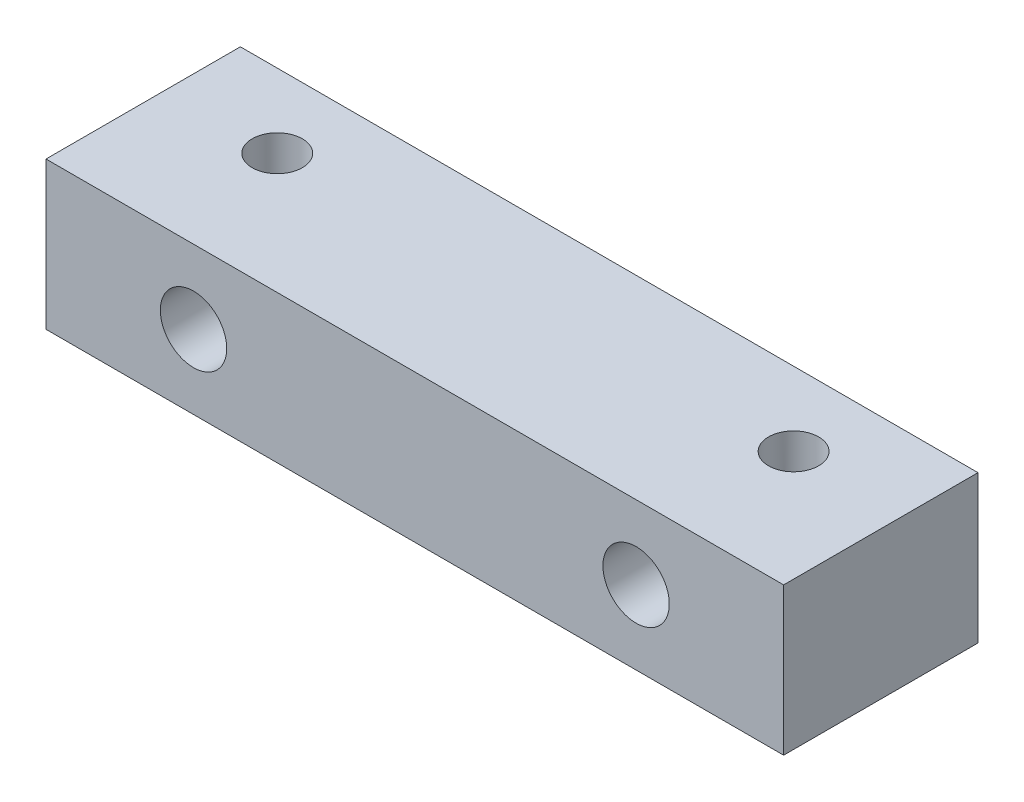
from build123d import *

# Parameters (mm, degrees)
SKETCH1_W                      = 50
SKETCH1_H                      = 10
BOSS_EXTRUDE1_DEPTH            = 13.175
CBORE_FOR_M3_SHCS2_D           = 3.4
CBORE_FOR_M3_SHCS2_CBORE_D     = 6.5
CBORE_FOR_M3_SHCS2_CBORE_DEPTH = 5
M4_CLEARANCE_HOLE1_D           = 4.5


with BuildPart() as part:
    # Sketch1 → Boss-Extrude1 (new body)
    with BuildSketch(Plane.XY):
        Rectangle(SKETCH1_W, SKETCH1_H)
    extrude(amount=BOSS_EXTRUDE1_DEPTH)

    # CBORE for M3 SHCS2 (through all)
    with Locations(Plane(origin=(0, -5, 0), x_dir=(-1, 0, 0), z_dir=(0, -1, 0))):
        with Locations((-17.5, -5), (17.5, -5)):
            CounterBoreHole(CBORE_FOR_M3_SHCS2_D / 2, CBORE_FOR_M3_SHCS2_CBORE_D / 2, CBORE_FOR_M3_SHCS2_CBORE_DEPTH)

    # M4 Clearance Hole1 (through all)
    with Locations(Plane(origin=(0, 0, 0), x_dir=(-1, 0, 0), z_dir=(0, 0, -1))):
        with Locations((-15, 0), (15, 0)):
            Hole(M4_CLEARANCE_HOLE1_D / 2)


solid = part.part
